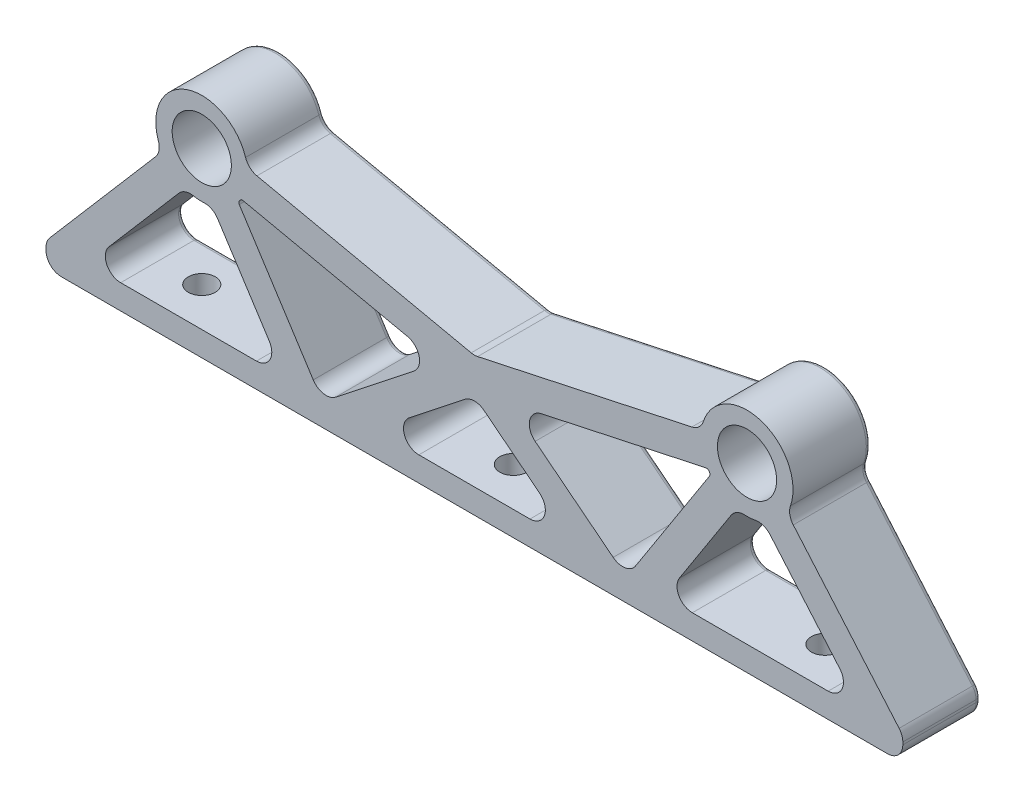
from build123d import *

# Parameters (mm, degrees)
SKETCH3_R           = 4.826
BOSS_EXTRUDE1_DEPTH = 12.7
FILLET1_R           = 2.5
CUT_EXTRUDE1_REACH  = 165.515
SKETCH4_R           = 2.2
SKETCH3_3_R         = 4.826
SKETCH3_3_R_2       = 2.5
BOSS_EXTRUDE2_DEPTH = 3.175
FILLET4_R           = 0.5
FILLET2_R           = 0.75


with BuildPart() as part:
    # Sketch3 → Boss-Extrude1 (new body)
    with BuildSketch(Plane.XY):
        with BuildLine():
            Line((19.05, 10.186822594), (19.05, 6.35))
            Line((19.05, 6.35), (158.75, 6.35))
            Line((158.75, 6.35), (158.75, 10.186822594))
            Line((158.75, 10.186822594), (139.853820201, 32.186011393))
            ThreePointArc((139.853820201, 32.186011393), (135.741428051, 43.02954556), (125.9111207, 36.876573936))
            Line((125.9111207, 36.876573936), (88.9, 28.907297391))
            Line((88.9, 28.907297391), (51.8888793, 36.876573936))
            ThreePointArc((51.8888793, 36.876573936), (42.058571949, 43.02954556), (37.946179799, 32.186011393))
            Line((37.946179799, 32.186011393), (19.05, 10.186822594))
        make_face()
        with BuildLine():
            Line((25.781430424, 10.35), (41.739075919, 28.928107309))
            ThreePointArc((41.739075919, 28.928107309), (43.93526316, 28.438708935), (46.177778996, 28.622752104))
            Line((46.177778996, 28.622752104), (57.949299721, 10.35))
            Line((57.949299721, 10.35), (25.781430424, 10.35))
        make_face(mode=Mode.SUBTRACT)
        with BuildLine():
            Line((64.113024766, 10.014678399), (50.381079567, 31.330567517))
            ThreePointArc((50.381079567, 31.330567517), (50.617519744, 31.653507617), (50.836395453, 31.988601171))
            Line((50.836395453, 31.988601171), (83.176304841, 25.025135151))
            Line((83.176304841, 25.025135151), (64.113024766, 10.014678399))
        make_face(mode=Mode.SUBTRACT)
        with BuildLine():
            Line((94.623695159, 25.025135151), (126.963604547, 31.988601171))
            ThreePointArc((126.963604547, 31.988601171), (127.182480256, 31.653507617), (127.418920433, 31.330567517))
            Line((127.418920433, 31.330567517), (113.686975234, 10.014678399))
            Line((113.686975234, 10.014678399), (94.623695159, 25.025135151))
        make_face(mode=Mode.SUBTRACT)
        with BuildLine():
            Line((119.850700279, 10.35), (131.622221004, 28.622752104))
            ThreePointArc((131.622221004, 28.622752104), (133.86473684, 28.438708935), (136.060924081, 28.928107309))
            Line((136.060924081, 28.928107309), (152.018569576, 10.35))
            Line((152.018569576, 10.35), (119.850700279, 10.35))
        make_face(mode=Mode.SUBTRACT)
        Polygon((88.9, 23.168018267), (105.178883199, 10.35), (72.621116801, 10.35), align=None, mode=Mode.SUBTRACT)
        with Locations((44.45, 35.921024484)):
            Circle(SKETCH3_R, mode=Mode.SUBTRACT)
        with Locations((133.35, 35.921024484)):
            Circle(SKETCH3_R, mode=Mode.SUBTRACT)
    extrude(amount=BOSS_EXTRUDE1_DEPTH)

    # Fillet1
    fillet1_edges = [part.edges().sort_by_distance(p)[0] for p in [
        (158.75, 6.35, 6.35),
        (158.75, 10.186822594, 6.35),
        (19.05, 6.35, 6.35),
        (19.05, 10.186822594, 6.35),
        (139.853820201, 32.186011393, 6.35),
        (125.9111207, 36.876573936, 6.35),
        (51.8888793, 36.876573936, 6.35),
        (152.018569576, 10.35, 6.35),
        (136.060924081, 28.928107309, 6.35),
        (131.622221004, 28.622752104, 6.35),
        (119.850700279, 10.35, 6.35),
        (113.686975234, 10.014678399, 6.35),
        (105.178883199, 10.35, 6.35),
        (25.781430424, 10.35, 6.35),
        (41.739075919, 28.928107309, 6.35),
        (46.177778996, 28.622752104, 6.35),
        (57.949299721, 10.35, 6.35),
        (72.621116801, 10.35, 6.35),
        (64.113024766, 10.014678399, 6.35),
        (37.946179799, 32.186011393, 6.35),
        (88.9, 23.168018267, 6.35),
        (94.623695159, 25.025135151, 6.35),
        (83.176304841, 25.025135151, 6.35),
        (88.9, 28.907297391, 6.35),
    ]]
    fillet(fillet1_edges, radius=FILLET1_R)

    # Sketch4 → Cut-Extrude1 (cut, up to next)
    with BuildSketch(Plane.XZ.offset(-6.35), mode=Mode.PRIVATE) as cut_extrude1_sk1:
        with Locations((38.1, 6.35)):
            Circle(SKETCH4_R)
    cut_extrude1_tool1 = extrude(cut_extrude1_sk1.sketch, amount=-CUT_EXTRUDE1_REACH, mode=Mode.PRIVATE) & part.part
    # Sketch4 → Cut-Extrude1 (cut, up to next)
    with BuildSketch(Plane.XZ.offset(-6.35), mode=Mode.PRIVATE) as cut_extrude1_sk2:
        with Locations((88.9, 6.35)):
            Circle(SKETCH4_R)
    cut_extrude1_tool2 = extrude(cut_extrude1_sk2.sketch, amount=-CUT_EXTRUDE1_REACH, mode=Mode.PRIVATE) & part.part
    # Sketch4 → Cut-Extrude1 (cut, up to next)
    with BuildSketch(Plane.XZ.offset(-6.35), mode=Mode.PRIVATE) as cut_extrude1_sk3:
        with Locations((139.7, 6.35)):
            Circle(SKETCH4_R)
    cut_extrude1_tool3 = extrude(cut_extrude1_sk3.sketch, amount=-CUT_EXTRUDE1_REACH, mode=Mode.PRIVATE) & part.part
    add(cut_extrude1_tool1.solids().sort_by_distance((38.1, 6.35, 6.35))[0], mode=Mode.SUBTRACT)
    add(cut_extrude1_tool2.solids().sort_by_distance((88.9, 6.35, 6.35))[0], mode=Mode.SUBTRACT)
    add(cut_extrude1_tool3.solids().sort_by_distance((139.7, 6.35, 6.35))[0], mode=Mode.SUBTRACT)

    # Sketch3<3> → Boss-Extrude2 (add)
    # profile 1 of 2: a face of its own
    with BuildSketch(Plane.XY):
        with Locations((44.45, 35.921024484)):
            Circle(SKETCH3_3_R)
        with Locations((44.45, 35.921024484)):
            Circle(SKETCH3_3_R_2, mode=Mode.SUBTRACT)
    # profile 2 of 2: a face of its own
    with BuildSketch(Plane.XY):
        with Locations((133.35, 35.921024484)):
            Circle(SKETCH3_3_R)
        with Locations((133.35, 35.921024484)):
            Circle(SKETCH3_3_R_2, mode=Mode.SUBTRACT)
    extrude(amount=BOSS_EXTRUDE2_DEPTH)

    # Fillet4
    fillet4_edges = [part.edges().sort_by_distance(p)[0] for p in [
        (127.418920433, 31.330567517, 6.35),
        (126.963604547, 31.988601171, 6.35),
        (50.836395453, 31.988601171, 6.35),
        (50.381079567, 31.330567517, 6.35),
    ]]
    fillet(fillet4_edges, radius=FILLET4_R)

    # Fillet2
    fillet2_edges = [part.edges().sort_by_distance(p)[0] for p in [
        (130.85, 35.921024484, 0),
        (41.95, 35.921024484, 0),
        (77.474982358, 12.031605804, 0),
        (82.822014634, 18.382203018, 0),
        (88.9, 22.486036534, 0),
        (94.977985366, 18.382203018, 0),
        (100.325017642, 12.031605804, 0),
        (88.9, 10.35, 0),
        (136.027855456, 28.452569492, 0),
        (142.784208978, 21.100767848, 0),
        (148.847387824, 11.806539437, 0),
        (135.50532278, 10.35, 0),
        (122.24022888, 11.653080885, 0),
        (126.547504566, 20.745347168, 0),
        (131.720098014, 28.156222534, 0),
        (133.86473684, 28.438708935, 0),
        (46.079901986, 28.156222534, 0),
        (51.252495434, 20.745347168, 0),
        (55.55977112, 11.653080885, 0),
        (42.29467722, 10.35, 0),
        (28.952612176, 11.806539437, 0),
        (35.015791022, 21.100767848, 0),
        (41.772144544, 28.452569492, 0),
        (43.93526316, 28.438708935, 0),
        (64.576322463, 29.030104482, 0),
        (79.888213065, 24.264039899, 0),
        (72.635931773, 16.725628799, 0),
        (64.313582416, 11.21361738, 0),
        (56.596194423, 21.682939508, 0),
        (158.594261094, 10.129118919, 0),
        (149.51787576, 20.934986843, 0),
        (140.328903302, 32.146949961, 0),
        (135.741428051, 43.02954556, 0),
        (125.509031043, 37.13260842, 0),
        (106.891891413, 32.781331884, 0),
        (88.9, 28.964594782, 0),
        (70.908108587, 32.781331884, 0),
        (52.290968957, 37.13260842, 0),
        (42.058571949, 43.02954556, 0),
        (37.471096698, 32.146949961, 0),
        (28.28212424, 20.934986843, 0),
        (19.205738906, 10.129118919, 0),
        (19.05, 9.055266953, 0),
        (19.782233047, 7.082233047, 0),
        (88.9, 6.35, 0),
        (158.017766953, 7.082233047, 0),
        (158.75, 9.055266953, 0),
        (121.203805577, 21.682939508, 0),
        (113.486417584, 11.21361738, 0),
        (105.164068227, 16.725628799, 0),
        (97.911786935, 24.264039899, 0),
        (113.223677537, 29.030104482, 0),
        (50.488428901, 31.321662917, 0),
        (50.617519744, 31.653507617, 0),
        (50.882566303, 31.891279929, 0),
        (127.311571099, 31.321662917, 0),
        (126.917433697, 31.891279929, 0),
        (127.182480256, 31.653507617, 0),
    ]]
    fillet(fillet2_edges, radius=FILLET2_R)


solid = part.part
